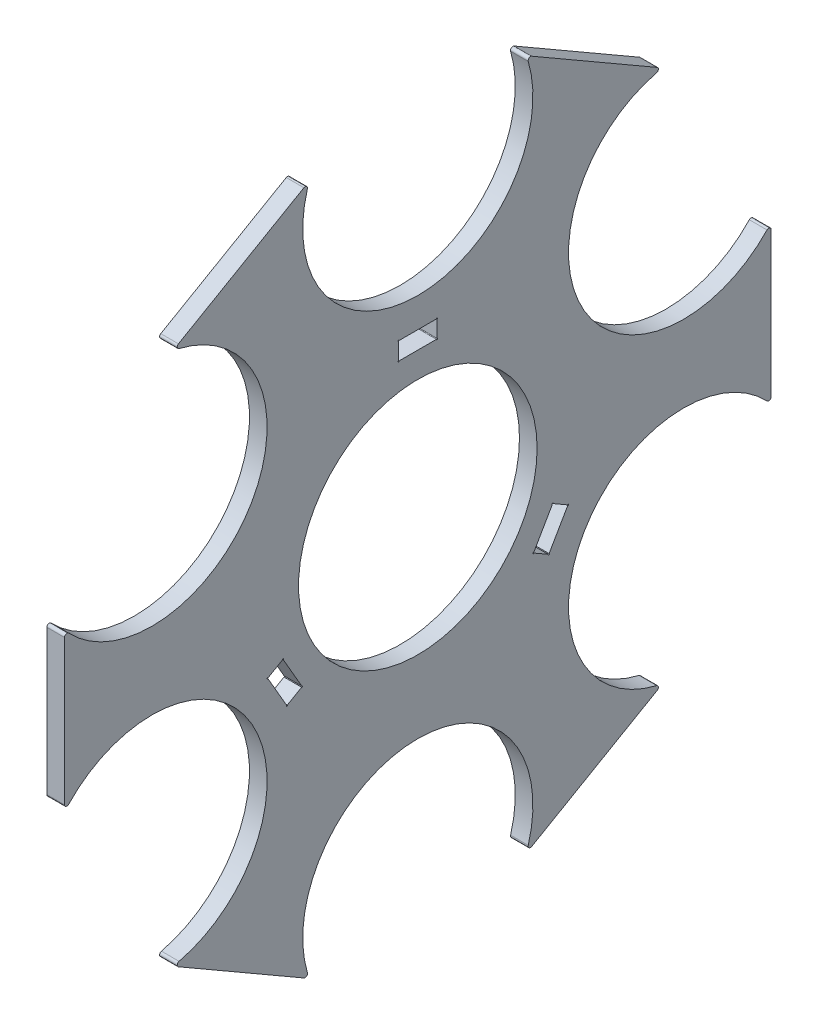
from build123d import *

# Parameters (mm, degrees)
SKETCH2_R           = 39.487475
BOSS_EXTRUDE1_DEPTH = 5.842
FILLET1_R           = 0.79375
CUT_EXTRUDE2_DEPTH  = 163.986308211
CIRPATTERN1_COUNT   = 3


with BuildPart() as part:
    # Sketch2 → Boss-Extrude1 (new body)
    with BuildSketch(Plane(origin=(0, 0, 0), x_dir=(0, 0, -1), z_dir=(1, 0, 0))):
        with BuildLine():
            ThreePointArc((116.947215895, 26.041480267), (54.99261314, 31.75), (81.02619141, 88.258519733))
            Line((81.02619141, 88.258519733), (35.921024484, 114.3))
            ThreePointArc((35.921024484, 114.3), (0, 63.5), (-35.921024484, 114.3))
            Line((-35.921024484, 114.3), (-81.02619141, 88.258519733))
            ThreePointArc((-81.02619141, 88.258519733), (-54.99261314, 31.75), (-116.947215895, 26.041480267))
            Line((-116.947215895, 26.041480267), (-116.947215895, -26.041480267))
            ThreePointArc((-116.947215895, -26.041480267), (-54.99261314, -31.75), (-81.02619141, -88.258519733))
            Line((-81.02619141, -88.258519733), (-35.921024484, -114.3))
            ThreePointArc((-35.921024484, -114.3), (0, -63.5), (35.921024484, -114.3))
            Line((35.921024484, -114.3), (81.02619141, -88.258519733))
            ThreePointArc((81.02619141, -88.258519733), (54.99261314, -31.75), (116.947215895, -26.041480267))
            Line((116.947215895, -26.041480267), (116.947215895, 26.041480267))
        make_face()
        Circle(SKETCH2_R, mode=Mode.SUBTRACT)
    extrude(amount=BOSS_EXTRUDE1_DEPTH)

    # Fillet1
    fillet1_edges = [part.edges().sort_by_distance(p)[0] for p in [
        (2.921, -114.3, 35.921024484),
        (2.921, -114.3, -35.921024484),
        (2.921, -88.258519733, -81.02619141),
        (2.921, -26.041480267, -116.947215895),
        (2.921, 88.258519733, -81.02619141),
        (2.921, 26.041480267, -116.947215895),
        (2.921, -88.258519733, 81.02619141),
        (2.921, -26.041480267, 116.947215895),
        (2.921, 26.041480267, 116.947215895),
        (2.921, 88.258519733, 81.02619141),
        (2.921, 114.3, -35.921024484),
        (2.921, 114.3, 35.921024484),
    ]]
    fillet(fillet1_edges, radius=FILLET1_R)

    # Sketch3 → Cut-Extrude2 (cut, through all)
    with BuildSketch(Plane(origin=(5.842, 0, 0), x_dir=(0, 0, -1), z_dir=(1, 0, 0))):
        with BuildLine():
            Line((6.1515625, 53.721), (-6.1515625, 53.721))
            ThreePointArc((-6.1515625, 53.721), (-6.490316502, 53.861316502), (-6.35, 53.5225625))
            Line((-6.35, 53.5225625), (-6.35, 48.0774375))
            ThreePointArc((-6.35, 48.0774375), (-6.490316502, 47.738683498), (-6.1515625, 47.879))
            Line((-6.1515625, 47.879), (6.1515625, 47.879))
            ThreePointArc((6.1515625, 47.879), (6.490316502, 47.738683498), (6.35, 48.0774375))
            Line((6.35, 48.0774375), (6.35, 53.5225625))
            ThreePointArc((6.35, 53.5225625), (6.490316502, 53.861316502), (6.1515625, 53.721))
        make_face()
    cut_extrude2 = extrude(amount=-CUT_EXTRUDE2_DEPTH, mode=Mode.SUBTRACT)

    # CirPattern1: Cut-Extrude2 ×3 about axis
    cirpattern1_axis = Axis((5.842, 0, 0), (-1, 0, 0))
    for i in range(1, CIRPATTERN1_COUNT):
        add(cut_extrude2.rotate(cirpattern1_axis, i * 360 / CIRPATTERN1_COUNT), mode=Mode.SUBTRACT)


solid = part.part
